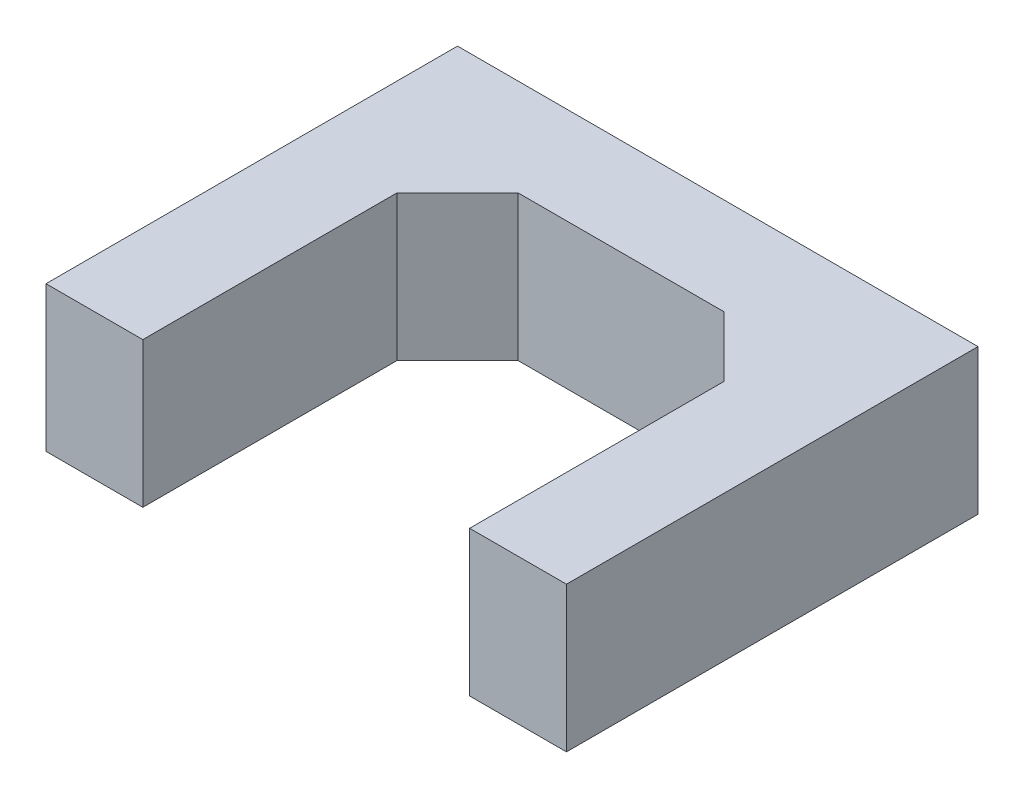
from build123d import *

# Parameters (mm, degrees)
EXTRUDE_1_DEPTH     = 12
CHAMFER_1_SIZE      = 5
SKETCH_2_W          = 39
SKETCH_2_H          = 8
CUT_EXTRUDE_1_DEPTH = 4
RIB_1_REACH         = 43.979
SKETCH_3_WALLS_W    = 1.6
SKETCH_3_WALLS_H    = 93.958322994
SKETCH_4_W          = 3
SKETCH_4_H          = 4
CUT_EXTRUDE_2_DEPTH = 24
WRAP_1_OUTLINE_W    = 1.732731782
WRAP_1_OUTLINE_H    = 0.670734883
WRAP_1_DEPTH        = 0.5
CHAMFER_2_SIZE      = 3


# Read off the part's stored shape, not the designer's step: 包覆1
with BuildPart() as part:
    # 草图1 → 凸台-拉伸1 (new body)
    with BuildSketch(Plane(origin=(0, 0, 0), x_dir=(1, 0, 0), z_dir=(0, 1, 0))):
        Polygon((-21.5, 0), (-21.5, -34), (-13.5, -34), (-13.5, -8), (13.5, -8), (13.5, -34), (21.5, -34), (21.5, 0), align=None)
    extrude(amount=EXTRUDE_1_DEPTH)

    # 倒角1
    chamfer_1_edges = [part.edges().sort_by_distance(p)[0] for p in [
        (13.5, 6, 8),
        (-13.5, 6, 8),
    ]]
    chamfer(chamfer_1_edges, length=CHAMFER_1_SIZE)

    # 草图2 → 切除-拉伸1 (cut)
    with BuildSketch(Plane(origin=(0, 0, 0), x_dir=(-1, 0, 0), z_dir=(0, 0, -1))):
        with Locations((0, 6)):
            Rectangle(SKETCH_2_W, SKETCH_2_H)
    extrude(amount=-CUT_EXTRUDE_1_DEPTH, mode=Mode.SUBTRACT)

    # 草图3 walls → 筋1 (add, up to next)
    with BuildSketch(Plane(origin=(0, 0, 0), x_dir=(-1, 0, 0), z_dir=(0, 0, -1)), mode=Mode.PRIVATE) as rib_1_sk1:
        with Locations((0, 6)):
            Rectangle(SKETCH_3_WALLS_W, SKETCH_3_WALLS_H)
    rib_1_tool1 = extrude(rib_1_sk1.sketch, amount=-RIB_1_REACH, mode=Mode.PRIVATE) - part.part
    # 草图3 walls → 筋1 (add, up to next)
    with BuildSketch(Plane(origin=(0, 0, 0), x_dir=(-1, 0, 0), z_dir=(0, 0, -1)), mode=Mode.PRIVATE) as rib_1_sk2:
        with Locations((-11.92165738, 6)):
            Rectangle(SKETCH_3_WALLS_W, SKETCH_3_WALLS_H)
    rib_1_tool2 = extrude(rib_1_sk2.sketch, amount=-RIB_1_REACH, mode=Mode.PRIVATE) - part.part
    # 草图3 walls → 筋1 (add, up to next)
    with BuildSketch(Plane(origin=(0, 0, 0), x_dir=(-1, 0, 0), z_dir=(0, 0, -1)), mode=Mode.PRIVATE) as rib_1_sk3:
        with Locations((11.92165738, 6)):
            Rectangle(SKETCH_3_WALLS_W, SKETCH_3_WALLS_H)
    rib_1_tool3 = extrude(rib_1_sk3.sketch, amount=-RIB_1_REACH, mode=Mode.PRIVATE) - part.part
    add(rib_1_tool1.solids().sort_by_distance((0, 6, 0))[0])
    add(rib_1_tool2.solids().sort_by_distance((11.92165738, 6, 0))[0])
    add(rib_1_tool3.solids().sort_by_distance((-11.92165738, 6, 0))[0])

    # 草图4 → 切除-拉伸2 (cut)
    with BuildSketch(Plane(origin=(0, 0, 4), x_dir=(-1, 0, 0), z_dir=(0, 0, -1))):
        with Locations((18, 6)):
            Rectangle(SKETCH_4_W, SKETCH_4_H)
        with Locations((-18, 6)):
            Rectangle(SKETCH_4_W, SKETCH_4_H)
    extrude(amount=-CUT_EXTRUDE_2_DEPTH, mode=Mode.SUBTRACT)

    # 包覆1 outline → 包覆1 (cut)
    # profile 1 of 8: a face of its own
    with BuildSketch(Plane(origin=(0, 0, 0), x_dir=(1, 0, 0), z_dir=(0, 1, 0))):
        with BuildLine():
            Line((-12.615033035, -1.67632273), (-13.439477996, -3.191589686))
            add(Edge.make_bspline(
                [(-13.439477996, -3.191589686), (-13.44701534, -3.208077482), (-13.464165339, -3.245592772), (-13.486411778, -3.311987928), (-13.508567102, -3.394981762), (-13.522653841, -3.456164502), (-13.530306678, -3.489402961)],
                knots=[0, 0, 0, 0, 0.174215202, 0.396398282, 0.672084143, 1, 1, 1, 1], degree=3))
            Line((-13.530306678, -3.489402961), (-13.542533616, -3.489402961))
            add(Edge.make_bspline(
                [(-13.542533616, -3.489402961), (-13.547573444, -3.469550643), (-13.558708363, -3.425689237), (-13.581855906, -3.354876462), (-13.612899632, -3.272730319), (-13.63644392, -3.214249203), (-13.649082647, -3.182856159)],
                knots=[0, 0, 0, 0, 0.189110496, 0.41781782, 0.68748082, 1, 1, 1, 1], degree=3))
            Line((-13.649082647, -3.182856159), (-14.475274313, -1.67632273))
            Line((-14.475274313, -1.67632273), (-15.645566947, -1.67632273))
            Line((-15.645566947, -1.67632273), (-14.170474216, -3.969746953))
            Line((-14.170474216, -3.969746953), (-15.5337778, -6.259677765))
            Line((-15.5337778, -6.259677765), (-14.333791173, -6.259677765))
            Line((-14.333791173, -6.259677765), (-13.64384253, -4.862313425))
            add(Edge.make_bspline(
                [(-13.64384253, -4.862313425), (-13.616639279, -4.802836286), (-13.560570052, -4.680246628), (-13.520989724, -4.551372823), (-13.500612686, -4.485025053)],
                knots=[0, 0, 0, 0, 0.485172572, 1, 1, 1, 1], degree=3))
            Line((-13.500612686, -4.485025053), (-13.4892591, -4.485025053))
            add(Edge.make_bspline(
                [(-13.4892591, -4.485025053), (-13.467252014, -4.549047373), (-13.421724022, -4.681495967), (-13.367207197, -4.810509029), (-13.339042434, -4.877160421)],
                knots=[0, 0, 0, 0, 0.483374856, 1, 1, 1, 1], degree=3))
            Line((-13.339042434, -4.877160421), (-12.591452512, -6.259677765))
            Line((-12.591452512, -6.259677765), (-11.509368501, -6.259677765))
            Line((-11.509368501, -6.259677765), (-12.878785554, -3.987214007))
            Line((-12.878785554, -3.987214007), (-11.453473928, -1.67632273))
            Line((-11.453473928, -1.67632273), (-12.615033035, -1.67632273))
        make_face()
    # profile 2 of 8: a face of its own
    with BuildSketch(Plane(origin=(0, 0, 0), x_dir=(1, 0, 0), z_dir=(0, 1, 0))):
        with BuildLine():
            Line((16.717391164, -1.67632273), (16.717391164, -3.509490073))
            add(Edge.make_bspline(
                [(16.717391164, -3.509490073), (16.717235621, -3.539201), (16.716933206, -3.596966686), (16.709464175, -3.680607176), (16.698988348, -3.758693337), (16.685854841, -3.831411051), (16.666100671, -3.897712981), (16.643883969, -3.958988053), (16.615655623, -4.013661892), (16.584470883, -4.063388702), (16.548010967, -4.106176344), (16.508772451, -4.144823944), (16.46361749, -4.17573058), (16.41538833, -4.202662624), (16.362264776, -4.222436417), (16.305284354, -4.237461684), (16.244014377, -4.246221247), (16.20184953, -4.247049437), (16.180279246, -4.247473115)],
                knots=[0, 0, 0, 0, 0.085716409, 0.166654752, 0.242108794, 0.313128921, 0.379605321, 0.441557985, 0.500927173, 0.55686173, 0.610542264, 0.662837259, 0.715287264, 0.767925358, 0.821914045, 0.878363675, 0.937774465, 1, 1, 1, 1], degree=3))
            add(Edge.make_bspline(
                [(16.180279246, -4.247473115), (16.159854147, -4.246825979), (16.119600571, -4.24555061), (16.060625001, -4.234703272), (16.004257567, -4.217230141), (15.950608358, -4.192469234), (15.899652219, -4.161038634), (15.852158728, -4.121650805), (15.806600514, -4.076226639), (15.749788196, -4.006132497), (15.688970666, -3.906958012), (15.63624647, -3.774757514), (15.605208789, -3.629689359), (15.601445213, -3.529148857), (15.599499692, -3.477176023)],
                knots=[0, 0, 0, 0, 0.057169533, 0.112669133, 0.167342001, 0.222069563, 0.277730647, 0.334526824, 0.394488953, 0.457653083, 0.586869189, 0.71859745, 0.85453337, 1, 1, 1, 1], degree=3))
            Line((15.599499692, -3.477176023), (15.599499692, -1.67632273))
            Line((15.599499692, -1.67632273), (14.649291941, -1.67632273))
            Line((14.649291941, -1.67632273), (14.649291941, -3.533070597))
            add(Edge.make_bspline(
                [(14.649291941, -3.533070597), (14.649137175, -3.561908719), (14.648836516, -3.617931697), (14.641375693, -3.698956226), (14.630898589, -3.774426939), (14.617770621, -3.844543), (14.597932251, -3.908502823), (14.575569196, -3.967499244), (14.548636742, -4.020969529), (14.516897318, -4.068730622), (14.480840327, -4.110638571), (14.441568627, -4.148034888), (14.39713217, -4.178649676), (14.348946567, -4.204361378), (14.295883044, -4.223383106), (14.239076944, -4.237119283), (14.178270349, -4.24634976), (14.136378327, -4.247091204), (14.114800081, -4.247473115)],
                knots=[0, 0, 0, 0, 0.085015077, 0.165156308, 0.239708055, 0.309753324, 0.375212769, 0.436915916, 0.495663209, 0.551383879, 0.60558226, 0.658430978, 0.710831461, 0.764214474, 0.819081954, 0.876554393, 0.936414152, 1, 1, 1, 1], degree=3))
            add(Edge.make_bspline(
                [(14.114800081, -4.247473115), (14.093222036, -4.246760638), (14.051011963, -4.245366918), (13.989124895, -4.235622279), (13.930383493, -4.219144861), (13.875285078, -4.195467769), (13.823669311, -4.165218156), (13.775436264, -4.12811366), (13.730095344, -4.084667571), (13.688952312, -4.034226398), (13.651913403, -3.978924623), (13.618925059, -3.918915843), (13.592442748, -3.853915079), (13.569165129, -3.785290228), (13.553508552, -3.711869811), (13.539426363, -3.634854249), (13.533203873, -3.552967294), (13.532009275, -3.496976959), (13.531400469, -3.468442496)],
                knots=[0, 0, 0, 0, 0.059271196, 0.115943848, 0.171643091, 0.226462573, 0.280233515, 0.335581376, 0.393277557, 0.452364999, 0.514032216, 0.575947884, 0.640116132, 0.706633845, 0.774733895, 0.846130956, 0.92158342, 1, 1, 1, 1], degree=3))
            Line((13.531400469, -3.468442496), (13.531400469, -1.67632273))
            Line((13.531400469, -1.67632273), (12.581192718, -1.67632273))
            Line((12.581192718, -1.67632273), (12.581192718, -4.918207998))
            Line((12.581192718, -4.918207998), (13.527907058, -4.918207998))
            Line((13.527907058, -4.918207998), (13.527907058, -4.388956255))
            Line((13.527907058, -4.388956255), (13.539260643, -4.388956255))
            add(Edge.make_bspline(
                [(13.539260643, -4.388956255), (13.56857912, -4.433583239), (13.626679004, -4.522019711), (13.735386314, -4.637178382), (13.855573318, -4.739365793), (13.989821444, -4.822755118), (14.13159163, -4.890201732), (14.278830643, -4.938634333), (14.429739794, -4.968561836), (14.531837796, -4.972254928), (14.582917135, -4.974102572)],
                knots=[0, 0, 0, 0, 0.128014629, 0.253684233, 0.378741658, 0.505990299, 0.632028886, 0.754957451, 0.877405914, 1, 1, 1, 1], degree=3))
            add(Edge.make_bspline(
                [(14.582917135, -4.974102572), (14.637796638, -4.972444042), (14.743713514, -4.969243096), (14.895580894, -4.939448882), (15.034902014, -4.892927596), (15.160041646, -4.824697848), (15.272314307, -4.737818328), (15.369411047, -4.630660959), (15.453852117, -4.505054219), (15.496336725, -4.41121758), (15.51827789, -4.362755673)],
                knots=[0, 0, 0, 0, 0.137645392, 0.26565419, 0.387004445, 0.505070133, 0.621740726, 0.741756338, 0.866630131, 1, 1, 1, 1], degree=3))
            add(Edge.make_bspline(
                [(15.51827789, -4.362755673), (15.550339625, -4.411333486), (15.612769549, -4.505923164), (15.723507856, -4.631179678), (15.844117538, -4.738068484), (15.976952125, -4.824172067), (16.119550236, -4.892816537), (16.273787331, -4.938933071), (16.437905088, -4.969123306), (16.55102195, -4.972413439), (16.609095427, -4.974102572)],
                knots=[0, 0, 0, 0, 0.132945892, 0.258869396, 0.38103538, 0.500299989, 0.619692696, 0.741597276, 0.867337685, 1, 1, 1, 1], degree=3))
            add(Edge.make_bspline(
                [(16.609095427, -4.974102572), (16.651934493, -4.973089134), (16.734971135, -4.971124748), (16.855486308, -4.95618752), (16.967745317, -4.931307613), (17.07155443, -4.895072579), (17.167754026, -4.84975533), (17.255313749, -4.79348614), (17.335315952, -4.727614842), (17.404710916, -4.649807892), (17.46760141, -4.563507184), (17.521821021, -4.466806373), (17.567232245, -4.359557684), (17.603403017, -4.242053871), (17.63217397, -4.114747118), (17.652957185, -3.977595378), (17.665058054, -3.830228563), (17.66673356, -3.728724573), (17.667598915, -3.676300441)],
                knots=[0, 0, 0, 0, 0.06707408, 0.13001232, 0.189847355, 0.246799203, 0.301858308, 0.355986544, 0.409397716, 0.463618034, 0.518790274, 0.576357404, 0.636819633, 0.700841656, 0.768638516, 0.841047345, 0.917905148, 1, 1, 1, 1], degree=3))
            Line((17.667598915, -3.676300441), (17.667598915, -1.67632273))
            Line((17.667598915, -1.67632273), (16.717391164, -1.67632273))
        make_face()
    # profile 3 of 8: a face of its own
    with BuildSketch(Plane(origin=(0, 0, 0), x_dir=(1, 0, 0), z_dir=(0, 1, 0))):
        with BuildLine():
            Line((10.792566363, -1.67632273), (10.792566363, -3.509490073))
            add(Edge.make_bspline(
                [(10.792566363, -3.509490073), (10.79241082, -3.539201), (10.792108405, -3.596966686), (10.784639374, -3.680607176), (10.774163547, -3.758693337), (10.76103004, -3.831411051), (10.74127587, -3.897712981), (10.719059168, -3.958988053), (10.690830822, -4.013661892), (10.659646082, -4.063388702), (10.623186166, -4.106176344), (10.58394765, -4.144823944), (10.538792689, -4.17573058), (10.490563529, -4.202662624), (10.437439975, -4.222436417), (10.380459553, -4.237461684), (10.319189576, -4.246221247), (10.277024729, -4.247049437), (10.255454445, -4.247473115)],
                knots=[0, 0, 0, 0, 0.085716409, 0.166654752, 0.242108794, 0.313128921, 0.379605321, 0.441557985, 0.500927173, 0.55686173, 0.610542264, 0.662837259, 0.715287264, 0.767925358, 0.821914045, 0.878363675, 0.937774465, 1, 1, 1, 1], degree=3))
            add(Edge.make_bspline(
                [(10.255454445, -4.247473115), (10.235029346, -4.246825979), (10.19477577, -4.24555061), (10.1358002, -4.234703272), (10.079432766, -4.217230141), (10.025783557, -4.192469234), (9.974827418, -4.161038634), (9.927333927, -4.121650805), (9.881775713, -4.076226639), (9.824963395, -4.006132497), (9.764145865, -3.906958012), (9.711421669, -3.774757514), (9.680383988, -3.629689359), (9.676620412, -3.529148857), (9.674674891, -3.477176023)],
                knots=[0, 0, 0, 0, 0.057169533, 0.112669133, 0.167342001, 0.222069563, 0.277730647, 0.334526824, 0.394488953, 0.457653083, 0.586869189, 0.71859745, 0.85453337, 1, 1, 1, 1], degree=3))
            Line((9.674674891, -3.477176023), (9.674674891, -1.67632273))
            Line((9.674674891, -1.67632273), (8.72446714, -1.67632273))
            Line((8.72446714, -1.67632273), (8.72446714, -3.533070597))
            add(Edge.make_bspline(
                [(8.72446714, -3.533070597), (8.724312374, -3.561908719), (8.724011715, -3.617931697), (8.716550892, -3.698956226), (8.706073788, -3.774426939), (8.69294582, -3.844543), (8.67310745, -3.908502823), (8.650744395, -3.967499244), (8.623811941, -4.020969529), (8.592072517, -4.068730622), (8.556015526, -4.110638571), (8.516743826, -4.148034888), (8.472307369, -4.178649676), (8.424121766, -4.204361378), (8.371058243, -4.223383106), (8.314252143, -4.237119283), (8.253445549, -4.24634976), (8.211553526, -4.247091204), (8.18997528, -4.247473115)],
                knots=[0, 0, 0, 0, 0.085015077, 0.165156308, 0.239708055, 0.309753324, 0.375212769, 0.436915916, 0.495663209, 0.551383879, 0.60558226, 0.658430978, 0.710831461, 0.764214474, 0.819081954, 0.876554393, 0.936414152, 1, 1, 1, 1], degree=3))
            add(Edge.make_bspline(
                [(8.18997528, -4.247473115), (8.168397235, -4.246760638), (8.126187162, -4.245366918), (8.064300094, -4.235622279), (8.005558692, -4.219144861), (7.950460277, -4.195467769), (7.89884451, -4.165218156), (7.850611463, -4.12811366), (7.805270543, -4.084667571), (7.764127511, -4.034226398), (7.727088602, -3.978924623), (7.694100258, -3.918915843), (7.667617947, -3.853915079), (7.644340328, -3.785290228), (7.628683751, -3.711869811), (7.614601562, -3.634854249), (7.608379072, -3.552967294), (7.607184474, -3.496976959), (7.606575668, -3.468442496)],
                knots=[0, 0, 0, 0, 0.059271196, 0.115943848, 0.171643091, 0.226462573, 0.280233515, 0.335581376, 0.393277557, 0.452364999, 0.514032216, 0.575947884, 0.640116132, 0.706633845, 0.774733895, 0.846130956, 0.92158342, 1, 1, 1, 1], degree=3))
            Line((7.606575668, -3.468442496), (7.606575668, -1.67632273))
            Line((7.606575668, -1.67632273), (6.656367917, -1.67632273))
            Line((6.656367917, -1.67632273), (6.656367917, -4.918207998))
            Line((6.656367917, -4.918207998), (7.603082257, -4.918207998))
            Line((7.603082257, -4.918207998), (7.603082257, -4.388956255))
            Line((7.603082257, -4.388956255), (7.614435842, -4.388956255))
            add(Edge.make_bspline(
                [(7.614435842, -4.388956255), (7.643754319, -4.433583239), (7.701854203, -4.522019711), (7.810561513, -4.637178382), (7.930748517, -4.739365793), (8.064996643, -4.822755118), (8.206766829, -4.890201732), (8.354005842, -4.938634333), (8.504914993, -4.968561836), (8.607012995, -4.972254928), (8.658092334, -4.974102572)],
                knots=[0, 0, 0, 0, 0.128014629, 0.253684233, 0.378741658, 0.505990299, 0.632028886, 0.754957451, 0.877405914, 1, 1, 1, 1], degree=3))
            add(Edge.make_bspline(
                [(8.658092334, -4.974102572), (8.712971837, -4.972444042), (8.818888713, -4.969243096), (8.970756093, -4.939448882), (9.110077213, -4.892927596), (9.235216845, -4.824697848), (9.347489506, -4.737818328), (9.444586246, -4.630660959), (9.529027316, -4.505054219), (9.571511924, -4.41121758), (9.593453089, -4.362755673)],
                knots=[0, 0, 0, 0, 0.137645392, 0.26565419, 0.387004445, 0.505070133, 0.621740726, 0.741756338, 0.866630131, 1, 1, 1, 1], degree=3))
            add(Edge.make_bspline(
                [(9.593453089, -4.362755673), (9.625514824, -4.411333486), (9.687944748, -4.505923164), (9.798683055, -4.631179678), (9.919292737, -4.738068484), (10.052127324, -4.824172067), (10.194725435, -4.892816537), (10.34896253, -4.938933071), (10.513080287, -4.969123306), (10.626197149, -4.972413439), (10.684270626, -4.974102572)],
                knots=[0, 0, 0, 0, 0.132945892, 0.258869396, 0.38103538, 0.500299989, 0.619692696, 0.741597276, 0.867337685, 1, 1, 1, 1], degree=3))
            add(Edge.make_bspline(
                [(10.684270626, -4.974102572), (10.727109692, -4.973089134), (10.810146334, -4.971124748), (10.930661507, -4.95618752), (11.042920516, -4.931307613), (11.146729629, -4.895072579), (11.242929225, -4.84975533), (11.330488948, -4.79348614), (11.410491151, -4.727614842), (11.479886115, -4.649807892), (11.542776609, -4.563507184), (11.59699622, -4.466806373), (11.642407444, -4.359557684), (11.678578216, -4.242053871), (11.707349169, -4.114747118), (11.728132384, -3.977595378), (11.740233253, -3.830228563), (11.741908759, -3.728724573), (11.742774114, -3.676300441)],
                knots=[0, 0, 0, 0, 0.06707408, 0.13001232, 0.189847355, 0.246799203, 0.301858308, 0.355986544, 0.409397716, 0.463618034, 0.518790274, 0.576357404, 0.636819633, 0.700841656, 0.768638516, 0.841047345, 0.917905148, 1, 1, 1, 1], degree=3))
            Line((11.742774114, -3.676300441), (11.742774114, -1.67632273))
            Line((11.742774114, -1.67632273), (10.792566363, -1.67632273))
        make_face()
    # profile 4 of 8: a face of its own
    with BuildSketch(Plane(origin=(0, 0, 0), x_dir=(1, 0, 0), z_dir=(0, 1, 0))):
        with BuildLine():
            add(Edge.make_bspline(
                [(5.650265592, -5.365364587), (5.621123564, -5.383293407), (5.56313771, -5.418967585), (5.47206229, -5.46397975), (5.379341267, -5.502662814), (5.284757333, -5.534152281), (5.188171902, -5.558830547), (5.089484584, -5.576092916), (4.988799487, -5.586968817), (4.921043529, -5.588282143), (4.886955321, -5.588942882)],
                knots=[0, 0, 0, 0, 0.127233786, 0.253165617, 0.377466163, 0.500762357, 0.623696504, 0.747982893, 0.873209506, 1, 1, 1, 1], degree=3))
            add(Edge.make_bspline(
                [(4.886955321, -5.588942882), (4.843802336, -5.587494415), (4.759100618, -5.58465133), (4.635279085, -5.565441366), (4.518053524, -5.532361452), (4.408273188, -5.484270264), (4.304363984, -5.424916688), (4.207403542, -5.351393116), (4.117280453, -5.264501779), (4.034884963, -5.164703482), (3.959920425, -5.055295158), (3.895256357, -4.936563453), (3.840130783, -4.81029495), (3.794741837, -4.676526637), (3.759568339, -4.534857016), (3.735844525, -4.385523577), (3.720497649, -4.228286945), (3.718539678, -4.120874447), (3.71753604, -4.065815751)],
                knots=[0, 0, 0, 0, 0.060152421, 0.118068621, 0.174205645, 0.229467369, 0.284739524, 0.340664898, 0.398645051, 0.45886999, 0.520781972, 0.583261995, 0.647051654, 0.712633893, 0.779961, 0.850284319, 0.923257068, 1, 1, 1, 1], degree=3))
            Line((3.71753604, -4.065815751), (3.735876447, -4.065815751))
            add(Edge.make_bspline(
                [(3.735876447, -4.065815751), (3.76391463, -4.107114604), (3.818830478, -4.188002922), (3.918307157, -4.293431381), (4.026876295, -4.383457233), (4.146191447, -4.456379277), (4.274876872, -4.514056832), (4.41404905, -4.553513746), (4.562882485, -4.578959599), (4.665596237, -4.581522862), (4.718398248, -4.582840557)],
                knots=[0, 0, 0, 0, 0.128619679, 0.251915702, 0.372519084, 0.491554441, 0.61159748, 0.735204279, 0.863876587, 1, 1, 1, 1], degree=3))
            add(Edge.make_bspline(
                [(4.718398248, -4.582840557), (4.765630561, -4.581755496), (4.858136016, -4.579630383), (4.993099928, -4.560363029), (5.121190815, -4.531875892), (5.240794182, -4.487947609), (5.353854092, -4.434064313), (5.45859882, -4.366187255), (5.556526628, -4.287252269), (5.645043948, -4.196011497), (5.725652638, -4.096164885), (5.794338691, -3.986829603), (5.854427197, -3.871541877), (5.902325413, -3.748123018), (5.940182097, -3.617832246), (5.965480832, -3.479966835), (5.983149886, -3.335275567), (5.984792422, -3.236187324), (5.985633034, -3.185476217)],
                knots=[0, 0, 0, 0, 0.066626477, 0.130489324, 0.192084633, 0.251482212, 0.309921276, 0.368506053, 0.427223245, 0.487078112, 0.547590813, 0.60800299, 0.669014444, 0.730819082, 0.794540337, 0.860217401, 0.928462448, 1, 1, 1, 1], degree=3))
            add(Edge.make_bspline(
                [(5.985633034, -3.185476217), (5.984360358, -3.130091422), (5.981859127, -3.021241911), (5.960123831, -2.861981292), (5.926472219, -2.70975954), (5.878136401, -2.564906821), (5.816117461, -2.427172339), (5.739565923, -2.297468237), (5.649823007, -2.175088625), (5.547119462, -2.061621241), (5.434334944, -1.957471581), (5.311656769, -1.867904237), (5.182273491, -1.790476641), (5.044434877, -1.729117676), (4.899477016, -1.679008393), (4.746326722, -1.646255006), (4.586005144, -1.624057712), (4.476559157, -1.62165631), (4.420584973, -1.620428156)],
                knots=[0, 0, 0, 0, 0.066956773, 0.131592292, 0.194032827, 0.255270542, 0.31593878, 0.376384905, 0.437088892, 0.499166035, 0.56121921, 0.622415411, 0.682558267, 0.743226505, 0.804576471, 0.867704141, 0.932339659, 1, 1, 1, 1], degree=3))
            add(Edge.make_bspline(
                [(4.420584973, -1.620428156), (4.357034609, -1.622040053), (4.233150504, -1.625182259), (4.052865888, -1.651520925), (3.884362666, -1.696446589), (3.726478149, -1.757012039), (3.581152478, -1.837886994), (3.446622284, -1.934970507), (3.324411447, -2.050773563), (3.21456449, -2.183121687), (3.116704248, -2.330630282), (3.031098292, -2.491403369), (2.959380992, -2.665596383), (2.901340945, -2.852515641), (2.854585796, -3.052042445), (2.823563039, -3.264766334), (2.802340793, -3.490136908), (2.800558671, -3.644806706), (2.799642339, -3.724334841)],
                knots=[0, 0, 0, 0, 0.063431946, 0.123653264, 0.181396505, 0.237262743, 0.292033151, 0.346976055, 0.402494132, 0.459657985, 0.518346728, 0.578942171, 0.641234399, 0.706137064, 0.77417602, 0.845622079, 0.920621942, 1, 1, 1, 1], degree=3))
            add(Edge.make_bspline(
                [(2.799642339, -3.724334841), (2.801309987, -3.818133567), (2.804573906, -4.001716337), (2.830339524, -4.270178619), (2.871827653, -4.525034176), (2.930059892, -4.766472298), (3.006283983, -4.994275789), (3.098752104, -5.20897702), (3.208318347, -5.410379234), (3.314302166, -5.566371089), (3.405998453, -5.683467962), (3.479032569, -5.764440356), (3.553762779, -5.841391368), (3.634068779, -5.910517958), (3.715338358, -5.976857928), (3.801653735, -6.034924439), (3.890075767, -6.088598865), (3.981964689, -6.137080182), (4.078048052, -6.178491395), (4.176886021, -6.215118915), (4.278576564, -6.247510711), (4.384366384, -6.270710364), (4.492814901, -6.291717015), (4.604899721, -6.305020229), (4.719985355, -6.314362143), (4.79785355, -6.315166279), (4.837174217, -6.315572338)],
                knots=[0, 0, 0, 0, 0.075822006, 0.148398752, 0.21781358, 0.284430458, 0.348958643, 0.411787047, 0.473190837, 0.534030466, 0.564024608, 0.593362414, 0.622154188, 0.650671454, 0.678974243, 0.70691459, 0.734684909, 0.762582599, 0.790829553, 0.819202712, 0.847788853, 0.877019784, 0.90670204, 0.937062387, 0.968218745, 1, 1, 1, 1], degree=3))
            add(Edge.make_bspline(
                [(4.837174217, -6.315572338), (4.879104928, -6.315345815), (4.960685463, -6.31490509), (5.079509515, -6.308370632), (5.191452006, -6.299257109), (5.296675581, -6.285263405), (5.394915775, -6.267144585), (5.486360042, -6.245013006), (5.571374233, -6.22056198), (5.624506421, -6.199262472), (5.650265592, -6.188936195)],
                knots=[0, 0, 0, 0, 0.151890854, 0.295519367, 0.431018031, 0.558701589, 0.67992281, 0.792735834, 0.899515653, 1, 1, 1, 1], degree=3))
            Line((5.650265592, -6.188936195), (5.650265592, -5.365364587))
        make_face()
        with BuildLine():
            add(Edge.make_bspline(
                [(3.74985009, -3.165389105), (3.750254882, -3.137416467), (3.751049696, -3.082491982), (3.760211159, -3.001950512), (3.774205481, -2.924635137), (3.793034288, -2.850229418), (3.818685773, -2.779402965), (3.84930331, -2.711457337), (3.88607892, -2.647001193), (3.927730923, -2.586149234), (3.973653044, -2.530052151), (4.024200478, -2.48125453), (4.078139945, -2.439779853), (4.13499793, -2.404706827), (4.197129487, -2.380127487), (4.261519967, -2.360455922), (4.329915828, -2.348738165), (4.376581333, -2.347627063), (4.400497861, -2.347057613)],
                knots=[0, 0, 0, 0, 0.071886063, 0.14114883, 0.208092036, 0.273806434, 0.338199047, 0.401503751, 0.465187818, 0.528713358, 0.590906623, 0.651248413, 0.708883752, 0.765617872, 0.822327303, 0.880108248, 0.938554305, 1, 1, 1, 1], degree=3))
            add(Edge.make_bspline(
                [(4.400497861, -2.347057613), (4.424416458, -2.347675502), (4.471327231, -2.348887347), (4.539418956, -2.359929187), (4.604244039, -2.375941104), (4.66450802, -2.401121738), (4.721781694, -2.431377238), (4.774580141, -2.469354709), (4.82292291, -2.51453744), (4.866964801, -2.565616194), (4.906320205, -2.622036131), (4.941157066, -2.681751291), (4.970424715, -2.745524689), (4.993316555, -2.812752782), (5.013424755, -2.883061713), (5.025767337, -2.957183415), (5.034071762, -3.034777997), (5.034966567, -3.087636925), (5.035425283, -3.114734647)],
                knots=[0, 0, 0, 0, 0.064082125, 0.125682203, 0.184561565, 0.242685864, 0.300310104, 0.357929057, 0.416476351, 0.477350116, 0.538418742, 0.600673085, 0.662495306, 0.726186421, 0.790949486, 0.858322363, 0.927370049, 1, 1, 1, 1], degree=3))
            add(Edge.make_bspline(
                [(5.035425283, -3.114734647), (5.034848816, -3.144728214), (5.033733426, -3.202761958), (5.027247281, -3.287215464), (5.013946681, -3.365355243), (4.996535657, -3.438158864), (4.974163814, -3.504869734), (4.946843145, -3.566103001), (4.914506085, -3.621814868), (4.876259363, -3.671090849), (4.833218973, -3.715080625), (4.785733068, -3.753445023), (4.732209002, -3.7850071), (4.674392994, -3.811560543), (4.611148587, -3.831131117), (4.543454695, -3.846262764), (4.470595428, -3.854998997), (4.420317139, -3.855798651), (4.394384392, -3.8562111)],
                knots=[0, 0, 0, 0, 0.080152719, 0.155085334, 0.226057657, 0.291711303, 0.35492822, 0.413767971, 0.470599087, 0.526609823, 0.579965018, 0.634752522, 0.689179924, 0.745572843, 0.804366302, 0.865703263, 0.930731865, 1, 1, 1, 1], degree=3))
            add(Edge.make_bspline(
                [(4.394384392, -3.8562111), (4.370786559, -3.855396052), (4.324595366, -3.853800651), (4.256819872, -3.845530807), (4.193021561, -3.82918698), (4.131966517, -3.808769115), (4.07548403, -3.780414165), (4.021909544, -3.746874814), (3.972577002, -3.706491337), (3.926108648, -3.661140471), (3.884368075, -3.610884918), (3.848781237, -3.556332443), (3.817573705, -3.49940712), (3.793315804, -3.438564819), (3.774124554, -3.374830674), (3.760210591, -3.307924816), (3.751033204, -3.23784125), (3.750249901, -3.189872955), (3.74985009, -3.165389105)],
                knots=[0, 0, 0, 0, 0.066778473, 0.130714434, 0.192624613, 0.252779534, 0.312436456, 0.370916825, 0.431229338, 0.492368088, 0.55436035, 0.615565603, 0.676354017, 0.73766995, 0.800450154, 0.864402021, 0.930788439, 1, 1, 1, 1], degree=3))
        make_face(mode=Mode.SUBTRACT)
    # profile 5 of 8: a face of its own
    with BuildSketch(Plane(origin=(0, 0, 0), x_dir=(1, 0, 0), z_dir=(0, 1, 0))):
        with BuildLine():
            Line((-0.945294092, -2.414305772), (0.375215209, -3.678920499))
            add(Edge.make_bspline(
                [(0.375215209, -3.678920499), (0.408451082, -3.710891055), (0.47298932, -3.77297227), (0.565965424, -3.864035901), (0.649479889, -3.952870605), (0.72686495, -4.036299627), (0.795589122, -4.116664538), (0.857239303, -4.192608491), (0.910391544, -4.265016482), (0.970627499, -4.354615598), (1.031924364, -4.46613664), (1.08326441, -4.604189012), (1.116919234, -4.74484471), (1.120841497, -4.840001531), (1.122805131, -4.887640653)],
                knots=[0, 0, 0, 0, 0.094570598, 0.183639524, 0.26682451, 0.344568497, 0.4169598, 0.483620474, 0.545111476, 0.601074208, 0.70498505, 0.805109178, 0.902430245, 1, 1, 1, 1], degree=3))
            add(Edge.make_bspline(
                [(1.122805131, -4.887640653), (1.122438554, -4.913583987), (1.12172375, -4.964172067), (1.112256996, -5.037337399), (1.099946654, -5.105976684), (1.080513132, -5.169545741), (1.055259043, -5.227644447), (1.025292208, -5.281277384), (0.989371607, -5.329326513), (0.947710216, -5.372710871), (0.900864542, -5.410981765), (0.84813978, -5.443673309), (0.790310288, -5.471824095), (0.726604188, -5.494046082), (0.657687851, -5.511837904), (0.58308828, -5.523478562), (0.503197558, -5.531697847), (0.448017208, -5.532590916), (0.419756198, -5.533048308)],
                knots=[0, 0, 0, 0, 0.071063086, 0.138569126, 0.201954306, 0.262033263, 0.320293343, 0.375327002, 0.430070611, 0.484252973, 0.539839285, 0.59541414, 0.653946846, 0.715786062, 0.780044323, 0.848788938, 0.922556172, 1, 1, 1, 1], degree=3))
            add(Edge.make_bspline(
                [(0.419756198, -5.533048308), (0.370775137, -5.531698448), (0.272660017, -5.528994512), (0.12642826, -5.507203025), (-0.018551854, -5.472120635), (-0.162276768, -5.422771064), (-0.30491584, -5.359755666), (-0.445937658, -5.282084957), (-0.586292402, -5.191287572), (-0.675933351, -5.121522785), (-0.721715798, -5.085891719)],
                knots=[0, 0, 0, 0, 0.117477016, 0.235320991, 0.353907816, 0.474951997, 0.599416115, 0.72757275, 0.860862854, 1, 1, 1, 1], degree=3))
            Line((-0.721715798, -5.085891719), (-0.721715798, -5.927803734))
            add(Edge.make_bspline(
                [(-0.721715798, -5.927803734), (-0.672397211, -5.958882665), (-0.574367689, -6.020657606), (-0.419436304, -6.098879199), (-0.260773618, -6.166786785), (-0.096064149, -6.220703361), (0.07302898, -6.264014022), (0.247805149, -6.292961722), (0.426893829, -6.312216985), (0.548087913, -6.314446666), (0.609273736, -6.315572338)],
                knots=[0, 0, 0, 0, 0.124264769, 0.246998478, 0.369696062, 0.492016045, 0.616249789, 0.741595625, 0.869542442, 1, 1, 1, 1], degree=3))
            add(Edge.make_bspline(
                [(0.609273736, -6.315572338), (0.664055192, -6.314729578), (0.770972297, -6.31308476), (0.9267325, -6.295543533), (1.074144661, -6.270210878), (1.212850722, -6.232712201), (1.342319001, -6.183343461), (1.464005971, -6.125141077), (1.576142786, -6.054694653), (1.679404673, -5.974488452), (1.772233276, -5.884519598), (1.853132468, -5.785598553), (1.920456194, -5.677781711), (1.977367667, -5.562907556), (2.019396544, -5.438724794), (2.0514088, -5.307047293), (2.069614255, -5.166749572), (2.071862384, -5.070513322), (2.073012882, -5.021263618)],
                knots=[0, 0, 0, 0, 0.07430633, 0.145023851, 0.212441315, 0.2771287, 0.339640796, 0.400242598, 0.459872196, 0.518981323, 0.577369232, 0.634933445, 0.69192549, 0.749522227, 0.808491257, 0.869430755, 0.9331801, 1, 1, 1, 1], degree=3))
            add(Edge.make_bspline(
                [(2.073012882, -5.021263618), (2.072390392, -4.987754039), (2.07113645, -4.92025245), (2.059252151, -4.818654287), (2.039986014, -4.716584517), (2.013386723, -4.614016732), (1.980759315, -4.510599733), (1.937726373, -4.407391051), (1.889240008, -4.302837763), (1.833252619, -4.197701927), (1.76879844, -4.092553318), (1.697444677, -3.986472349), (1.618835252, -3.87952659), (1.531515315, -3.773202717), (1.438662919, -3.664608594), (1.336742459, -3.556445216), (1.227989954, -3.447325129), (1.151288689, -3.376193895), (1.112324898, -3.340059647)],
                knots=[0, 0, 0, 0, 0.050458727, 0.101643897, 0.153848258, 0.206813219, 0.26117386, 0.31703482, 0.375103394, 0.434740259, 0.496332844, 0.560791787, 0.627271433, 0.696167188, 0.767987247, 0.842445575, 0.91996328, 1, 1, 1, 1], degree=3))
            Line((1.112324898, -3.340059647), (0.17259738, -2.476313815))
            Line((0.17259738, -2.476313815), (0.17259738, -2.45884676))
            Line((0.17259738, -2.45884676), (2.017118309, -2.45884676))
            Line((2.017118309, -2.45884676), (2.017118309, -1.67632273))
            Line((2.017118309, -1.67632273), (-0.945294092, -1.67632273))
            Line((-0.945294092, -1.67632273), (-0.945294092, -2.414305772))
        make_face()
    # profile 6 of 8: a face of its own
    with BuildSketch(Plane(origin=(0, 0, 0), x_dir=(1, 0, 0), z_dir=(0, 1, 0))):
        with BuildLine():
            add(Edge.make_bspline(
                [(-7.429064629, -3.894638619), (-7.427680318, -3.98986388), (-7.42498889, -4.175004264), (-7.405477807, -4.444011975), (-7.370209278, -4.695609266), (-7.323288236, -4.92999643), (-7.260794866, -5.146789137), (-7.186621102, -5.347119692), (-7.096181954, -5.529412296), (-6.993243511, -5.694625858), (-6.877124268, -5.841396599), (-6.747703926, -5.968044711), (-6.606770397, -6.076191497), (-6.452659156, -6.163872731), (-6.286223155, -6.232340336), (-6.107664061, -6.281231083), (-5.916796184, -6.310381934), (-5.785518825, -6.313812353), (-5.718166665, -6.315572338)],
                knots=[0, 0, 0, 0, 0.085139598, 0.165531475, 0.240956143, 0.312167116, 0.379061602, 0.442488579, 0.502902844, 0.560677369, 0.616246237, 0.669808014, 0.722179588, 0.774642284, 0.827861445, 0.88267352, 0.939805372, 1, 1, 1, 1], degree=3))
            add(Edge.make_bspline(
                [(-5.718166665, -6.315572338), (-5.654021226, -6.314055476), (-5.529198692, -6.31110377), (-5.34837244, -6.283632906), (-5.179719453, -6.23825219), (-5.023542297, -6.174401029), (-4.879399304, -6.0925537), (-4.748520671, -5.991908638), (-4.629225712, -5.873715867), (-4.52364737, -5.736508244), (-4.430602039, -5.581295651), (-4.350964051, -5.408130509), (-4.2812084, -5.218051172), (-4.227523623, -5.008873824), (-4.183776611, -4.782292832), (-4.152835797, -4.537556735), (-4.134548226, -4.274829781), (-4.132396069, -4.093793627), (-4.131284787, -4.000314298)],
                knots=[0, 0, 0, 0, 0.060341086, 0.117419527, 0.17165734, 0.224370542, 0.275789656, 0.327193438, 0.379310813, 0.433404484, 0.489698238, 0.549271151, 0.612545552, 0.680002259, 0.752277173, 0.829627207, 0.912026774, 1, 1, 1, 1], degree=3))
            add(Edge.make_bspline(
                [(-4.131284787, -4.000314298), (-4.132599815, -3.907990269), (-4.135154335, -3.728645418), (-4.155624024, -3.467687712), (-4.187983472, -3.222820267), (-4.234860618, -2.993856627), (-4.296117128, -2.781469339), (-4.368805213, -2.584530277), (-4.456554902, -2.404309245), (-4.557474334, -2.240740712), (-4.671506735, -2.094674742), (-4.797441317, -1.96680054), (-4.936892697, -1.859364473), (-5.087948015, -1.771210675), (-5.25132626, -1.704072842), (-5.425784211, -1.654547418), (-5.612695411, -1.625704087), (-5.741356342, -1.622215036), (-5.807248642, -1.620428156)],
                knots=[0, 0, 0, 0, 0.08417685, 0.16351848, 0.238527985, 0.30927978, 0.376409067, 0.439915046, 0.500463241, 0.558878993, 0.614849642, 0.669097251, 0.722087801, 0.774902522, 0.828096144, 0.88271852, 0.939935563, 1, 1, 1, 1], degree=3))
            add(Edge.make_bspline(
                [(-5.807248642, -1.620428156), (-5.872855216, -1.62190541), (-6.000297128, -1.624775), (-6.184993618, -1.652719358), (-6.357158411, -1.696651766), (-6.516756013, -1.759110625), (-6.664089266, -1.839023551), (-6.798528202, -1.937249071), (-6.919353791, -2.054524969), (-7.027986784, -2.188709314), (-7.123416161, -2.34106275), (-7.205472557, -2.511146963), (-7.275204613, -2.698585942), (-7.33128905, -2.90391166), (-7.375949305, -3.126526561), (-7.406316628, -3.367037509), (-7.426118013, -3.625021825), (-7.428061996, -3.802897177), (-7.429064629, -3.894638619)],
                knots=[0, 0, 0, 0, 0.06188749, 0.120217527, 0.175868632, 0.22929421, 0.281553812, 0.333656413, 0.385932628, 0.440048385, 0.496234878, 0.55522396, 0.61800239, 0.684736506, 0.755924722, 0.832135132, 0.913421591, 1, 1, 1, 1], degree=3))
        make_face()
        with BuildLine():
            add(Edge.make_bspline(
                [(-6.478856878, -3.918219143), (-6.478499521, -3.854741612), (-6.477807387, -3.731797396), (-6.468390344, -3.553878745), (-6.456031288, -3.388027258), (-6.437130168, -3.234360414), (-6.411645925, -3.093112214), (-6.382379053, -2.963704843), (-6.347290724, -2.846595224), (-6.304640922, -2.742228882), (-6.259444502, -2.648829086), (-6.206558758, -2.568663285), (-6.148468031, -2.500261621), (-6.084744104, -2.443695389), (-6.014631975, -2.400213578), (-5.939401521, -2.369359028), (-5.858553799, -2.350291949), (-5.802697405, -2.348153792), (-5.774061239, -2.347057613)],
                knots=[0, 0, 0, 0, 0.100208496, 0.194085293, 0.281228235, 0.362752387, 0.438395841, 0.50774493, 0.572153625, 0.631131321, 0.685602629, 0.735702133, 0.782315351, 0.826937205, 0.869665352, 0.911916186, 0.954841648, 1, 1, 1, 1], degree=3))
            add(Edge.make_bspline(
                [(-5.774061239, -2.347057613), (-5.745994341, -2.348101551), (-5.690911722, -2.350150328), (-5.611492715, -2.370164459), (-5.537331449, -2.402127347), (-5.468904869, -2.447152678), (-5.40603255, -2.505099333), (-5.349364031, -2.575819716), (-5.297900127, -2.658650246), (-5.251411795, -2.753630423), (-5.211674031, -2.861815339), (-5.177460847, -2.982578202), (-5.14623611, -3.11524923), (-5.123837043, -3.261082406), (-5.104367508, -3.419190448), (-5.090585476, -3.590212926), (-5.082933451, -3.77375259), (-5.081982932, -3.9001625), (-5.081492538, -3.965380189)],
                knots=[0, 0, 0, 0, 0.043445156, 0.08526318, 0.126097751, 0.168161073, 0.211608574, 0.258133225, 0.308225542, 0.362525305, 0.421797397, 0.486648233, 0.55704955, 0.632959157, 0.715255744, 0.804015677, 0.898887321, 1, 1, 1, 1], degree=3))
            add(Edge.make_bspline(
                [(-5.081492538, -3.965380189), (-5.081962668, -4.030890154), (-5.082874037, -4.157884304), (-5.090790538, -4.341967495), (-5.103561744, -4.513283892), (-5.121871664, -4.671783692), (-5.144797171, -4.81799956), (-5.174713613, -4.951378058), (-5.208120021, -5.072442806), (-5.247477052, -5.180537001), (-5.291668475, -5.276574993), (-5.341903273, -5.359691562), (-5.397841767, -5.42996366), (-5.458025334, -5.488841965), (-5.52509082, -5.533781356), (-5.597457579, -5.56584258), (-5.674887428, -5.585775376), (-5.728528068, -5.587877317), (-5.755720832, -5.588942882)],
                knots=[0, 0, 0, 0, 0.101930162, 0.197596415, 0.286640643, 0.369180502, 0.445810927, 0.516807924, 0.581767915, 0.641096542, 0.695609013, 0.746028651, 0.791800079, 0.835052216, 0.876511888, 0.916664146, 0.957753445, 1, 1, 1, 1], degree=3))
            add(Edge.make_bspline(
                [(-5.755720832, -5.588942882), (-5.784968279, -5.587983656), (-5.842450248, -5.586098425), (-5.925188649, -5.564812082), (-6.003001195, -5.532554207), (-6.073974547, -5.485006603), (-6.14028636, -5.426032551), (-6.199873586, -5.353311755), (-6.253048573, -5.267552298), (-6.300891946, -5.169095196), (-6.343593086, -5.057806312), (-6.379974637, -4.933319636), (-6.410072224, -4.795777396), (-6.435136645, -4.645349588), (-6.4552889, -4.481907165), (-6.468553172, -4.3055797), (-6.477771178, -4.116277195), (-6.478486579, -3.985770702), (-6.478856878, -3.918219143)],
                knots=[0, 0, 0, 0, 0.043706366, 0.085899052, 0.127118622, 0.169322569, 0.213170061, 0.259615486, 0.309574705, 0.363976551, 0.423326587, 0.487889452, 0.558021264, 0.634071151, 0.716216924, 0.804564116, 0.898840291, 1, 1, 1, 1], degree=3))
        make_face(mode=Mode.SUBTRACT)
    # profile 7 of 8: a face of its own
    with BuildSketch(Plane(origin=(0, 0, 0), x_dir=(1, 0, 0), z_dir=(0, 1, 0))):
        Polygon((-8.37927238, -2.682425055), (-8.37927238, -1.67632273), (-9.273585558, -1.67632273), (-9.273585558, -2.682425055), (-11.285790207, -2.682425055), (-11.285790207, -3.28940519), (-9.353060654, -6.259677765), (-8.37927238, -6.259677765), (-8.37927238, -3.353159938), (-7.820326644, -3.353159938), (-7.820326644, -2.682425055), align=None)
        with BuildLine():
            Line((-9.273585558, -3.353159938), (-9.273585558, -4.865806836))
            add(Edge.make_bspline(
                [(-9.273585558, -4.865806836), (-9.273313721, -4.899284952), (-9.27275111, -4.968573476), (-9.27149439, -5.076032328), (-9.266481495, -5.190412163), (-9.263099759, -5.269005181), (-9.26135862, -5.309470014)],
                knots=[0, 0, 0, 0, 0.226277191, 0.468318245, 0.72625541, 1, 1, 1, 1], degree=3))
            Line((-9.26135862, -5.309470014), (-9.278825674, -5.309470014))
            add(Edge.make_bspline(
                [(-9.278825674, -5.309470014), (-9.287950157, -5.287676266), (-9.308537388, -5.238503845), (-9.327599873, -5.188719461), (-9.338213658, -5.161000052)],
                knots=[0, 0, 0, 0, 0.443210786, 1, 1, 1, 1], degree=3))
            add(Edge.make_bspline(
                [(-9.338213658, -5.161000052), (-9.353185878, -5.126836581), (-9.385416671, -5.053292658), (-9.428048278, -4.985223976), (-9.450876158, -4.948775343)],
                knots=[0, 0, 0, 0, 0.464531537, 1, 1, 1, 1], degree=3))
            Line((-9.450876158, -4.948775343), (-10.481432359, -3.353159938))
            Line((-10.481432359, -3.353159938), (-9.273585558, -3.353159938))
        make_face(mode=Mode.SUBTRACT)
    # profile 8 of 8: a face of its own
    with BuildSketch(Plane(origin=(0, 0, 0), x_dir=(1, 0, 0), z_dir=(0, 1, 0))):
        with Locations((-2.594184013, -3.409054511)):
            Rectangle(WRAP_1_OUTLINE_W, WRAP_1_OUTLINE_H)
    extrude(amount=WRAP_1_DEPTH, mode=Mode.SUBTRACT)

    # 倒角2
    chamfer_2_edges = [part.edges().sort_by_distance(p)[0] for p in [
        (19.5, 9, 4),
        (19.5, 3, 4),
        (-19.5, 9, 4),
        (-19.5, 3, 4),
    ]]
    chamfer(chamfer_2_edges, length=CHAMFER_2_SIZE)


solid = part.part
